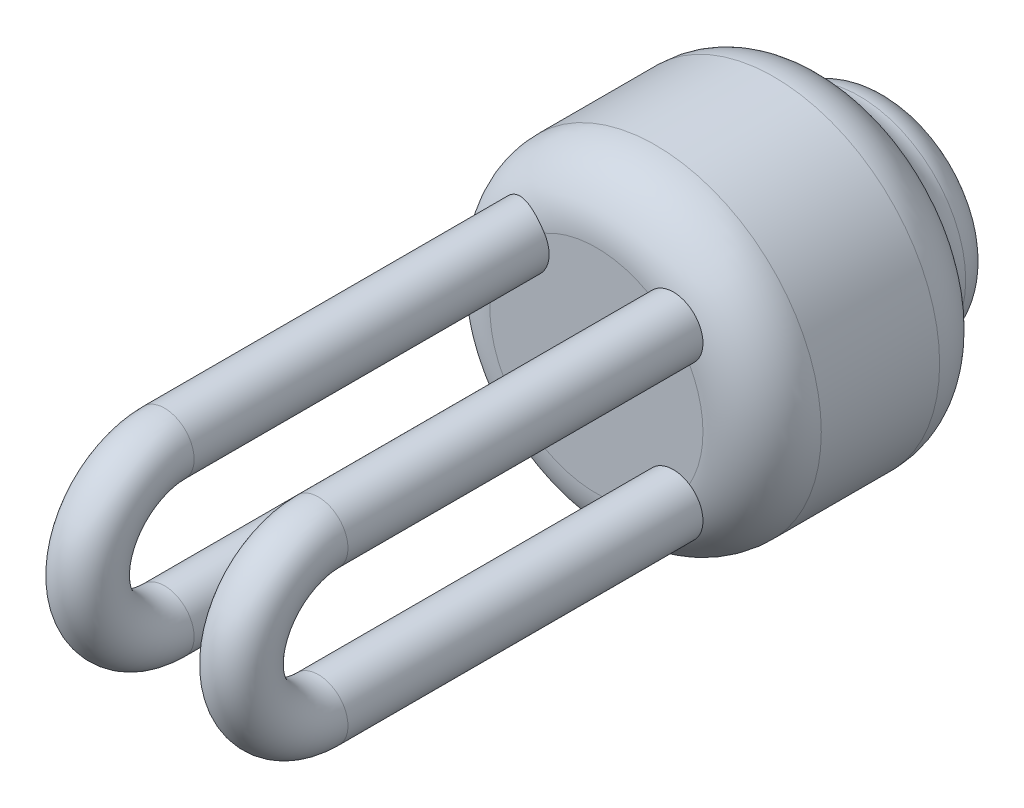
from build123d import *

# Parameters (mm, degrees)
SKETCH_1_R      = 28
EXTRUDE_1_DEPTH = 40
SKETCH_2_R      = 5
FILLET_1_R      = 10
SKETCH_4_R      = 18
EXTRUDE_2_DEPTH = 10
FILLET_2_R      = 6
FILLET_3_R      = 6


with BuildPart() as part:
    # 草图1 → 凸台-拉伸1 (new body)
    with BuildSketch(Plane.XY):
        Circle(SKETCH_1_R)
    extrude(amount=EXTRUDE_1_DEPTH)

    # 扫描1: sweep along a path in 草图3
    with BuildLine(Plane(origin=(-13, 0, 0), x_dir=(0, 0, -1), z_dir=(1, 0, 0))) as sweep_1_path:
        Line((-40, 13), (-100, 13))
        ThreePointArc((-100, 13), (-113, 0), (-100, -13))
        Line((-100, -13), (-40, -13))
    # 草图2 → 扫描1 (sweep)
    with BuildSketch(Plane.XY.offset(40)):
        with Locations((-13, 13)):
            Circle(SKETCH_2_R)
    sweep_1 = sweep(path=sweep_1_path.line)

    # 圆角1
    # the kernel refuses this fillet: 10 mm, written as the material it takes off along each edge
    with BuildSketch(Plane(origin=(0, 0, 0), x_dir=(1, 0, 0), z_dir=(0, -1, 0))) as fillet_1_piece_1:
        with BuildLine():
            CenterArc((28 - FILLET_1_R, FILLET_1_R), FILLET_1_R, 270, 90)
            Line((28 - FILLET_1_R, 0), (28, 0))
            Line((28, 0), (28, FILLET_1_R))
        make_face()
    revolve(axis=Axis((0, 0, 0), (0, 0, 1)), mode=Mode.SUBTRACT)
    with BuildSketch(Plane(origin=(0, 0, 40), x_dir=(1, 0, 0), z_dir=(0, -1, 0))) as fillet_1_piece_2_section:
        with BuildLine():
            CenterArc((28 - FILLET_1_R, -FILLET_1_R), FILLET_1_R, 0, 90)
            Line((28 - FILLET_1_R, 0), (28, 0))
            Line((28, 0), (28, -FILLET_1_R))
        make_face()
    fillet_1_piece_2 = revolve(axis=Axis((0, 0, 40), (0, 0, 1)), mode=Mode.PRIVATE)
    fillet_1_piece_2 = fillet_1_piece_2 - Plane(origin=(-13, -13, 37.183961808), x_dir=(1, 0, 0), z_dir=(0, 0, -1)) * Cylinder(5, 112, mode=Mode.PRIVATE)
    fillet_1_piece_2 = fillet_1_piece_2 - Plane(origin=(-13, 13, 37.183961808), x_dir=(1, 0, 0), z_dir=(0, 0, 1)) * Cylinder(5, 112, mode=Mode.PRIVATE)
    add(fillet_1_piece_2, mode=Mode.SUBTRACT)

    # 镜向1: 扫描1 across plane
    add(sweep_1.mirror(Plane(origin=(0, 0, 0), x_dir=(0, 0, 1), z_dir=(1, 0, 0))))

    # 草图4 → 凸台-拉伸2 (add)
    with BuildSketch(Plane(origin=(0, 0, 0), x_dir=(-1, 0, 0), z_dir=(0, 0, -1))):
        with Locations(Location((0, 0, 0), (0, 0, 180))):
            Circle(SKETCH_4_R)
    extrude(amount=EXTRUDE_2_DEPTH)

    # 圆角2
    fillet_2_edges = [part.edges().sort_by_distance(p)[0] for p in [
        (-18, 0, -10),
    ]]
    fillet(fillet_2_edges, radius=FILLET_2_R)

    # 圆角3
    fillet_3_edges = [part.edges().sort_by_distance(p)[0] for p in [
        (-18, 0, 0),
    ]]
    fillet(fillet_3_edges, radius=FILLET_3_R)


solid = part.part
